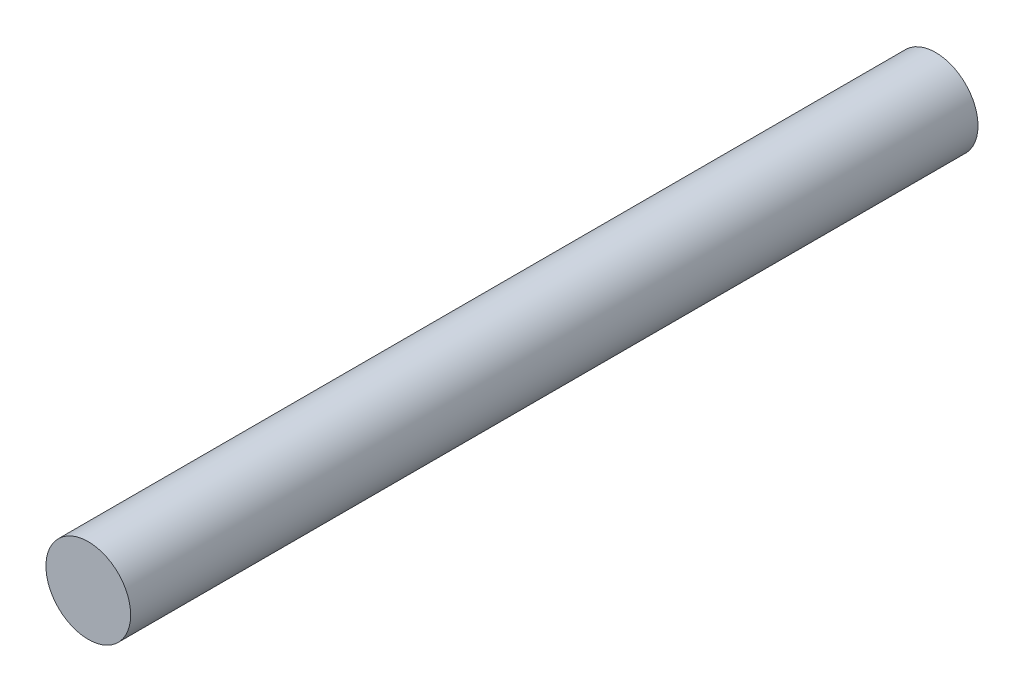
from build123d import *

# Parameters (mm, degrees)
SKETCH_1_R      = 2.5
EXTRUDE_1_DEPTH = 50


with BuildPart() as part:
    # 草图1 → 凸台-拉伸1 (new body)
    with BuildSketch(Plane.XY):
        with Locations((36.119111303, -58.196758832)):
            Circle(SKETCH_1_R)
    extrude(amount=EXTRUDE_1_DEPTH)


solid = part.part
